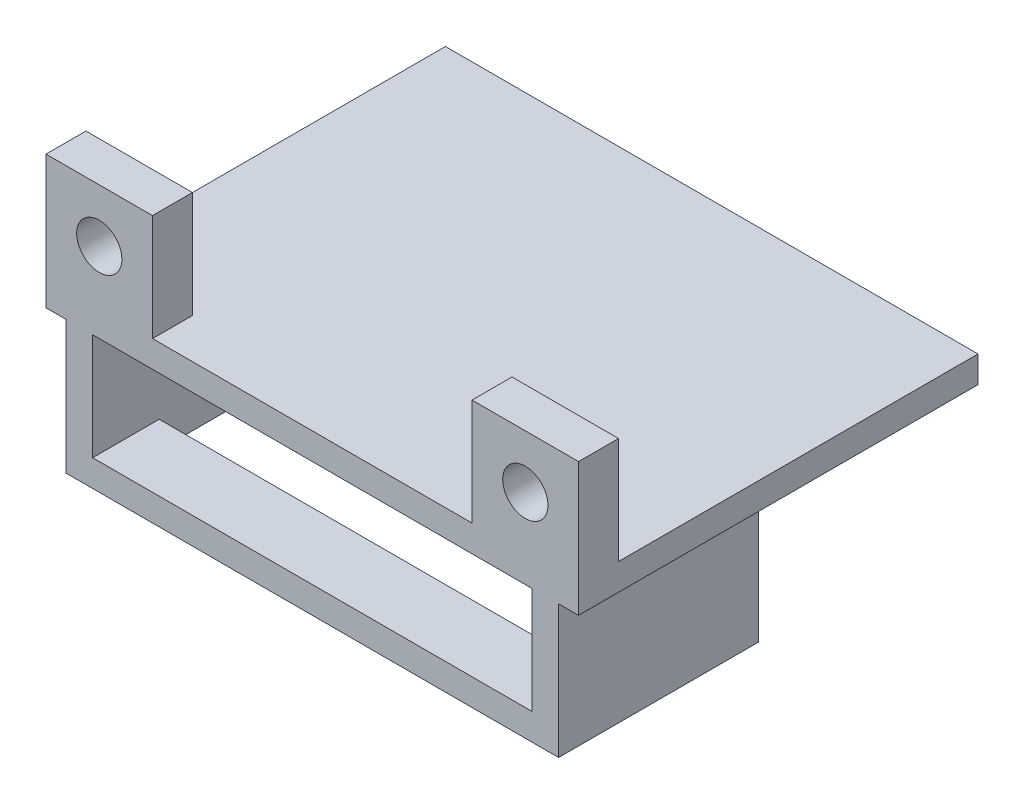
from build123d import *

# Parameters (mm, degrees)
SKETCH1_W            = 40
SKETCH1_H            = 30
BOSS_EXTRUDE1_DEPTH  = 1
SKETCH2_W            = 8
SKETCH2_H            = 3
BOSS_EXTRUDE2_DEPTH  = 8
M3_CLEARANCE_HOLE1_D = 3.4
BOSS_EXTRUDE3_DEPTH  = 5
SKETCH8_W            = 2
SKETCH8_H            = 10
BOSS_EXTRUDE4_DEPTH  = 10


with BuildPart() as part:
    # Sketch1 → Boss-Extrude1 (new, symmetric)
    with BuildSketch(Plane(origin=(0, 0, 0), x_dir=(1, 0, 0), z_dir=(0, 1, 0))):
        with Locations((20, 15)):
            Rectangle(SKETCH1_W, SKETCH1_H)
    extrude(amount=BOSS_EXTRUDE1_DEPTH, both=True)

    # Sketch2 → Boss-Extrude2 (add)
    with BuildSketch(Plane(origin=(0, 1, 0), x_dir=(1, 0, 0), z_dir=(0, 1, 0))):
        with Locations((4, 1.5)):
            Rectangle(SKETCH2_W, SKETCH2_H)
        with Locations((36, 1.5)):
            Rectangle(SKETCH2_W, SKETCH2_H)
    extrude(amount=BOSS_EXTRUDE2_DEPTH)

    # M3 Clearance Hole1 (through all)
    with Locations(Plane(origin=(0, 0, -3), x_dir=(-1, 0, 0), z_dir=(0, 0, -1))):
        with Locations((-4, 5), (-36, 5)):
            Hole(M3_CLEARANCE_HOLE1_D / 2)

    # Sketch7 → Boss-Extrude3 (add)
    with BuildSketch(Plane.XY):
        Polygon((1.5, -1), (1.5, -11), (38.5, -11), (38.5, -1), (36.5, -1), (36.5, -9), (3.5, -9), (3.5, -1), align=None)
    extrude(amount=-BOSS_EXTRUDE3_DEPTH)

    # Sketch8 → Boss-Extrude4 (add)
    with BuildSketch(Plane(origin=(0, 0, -5), x_dir=(-1, 0, 0), z_dir=(0, 0, -1))):
        with Locations((-37.5, -6)):
            Rectangle(SKETCH8_W, SKETCH8_H)
        with Locations((-2.5, -6)):
            Rectangle(SKETCH8_W, SKETCH8_H)
    extrude(amount=BOSS_EXTRUDE4_DEPTH)


solid = part.part
